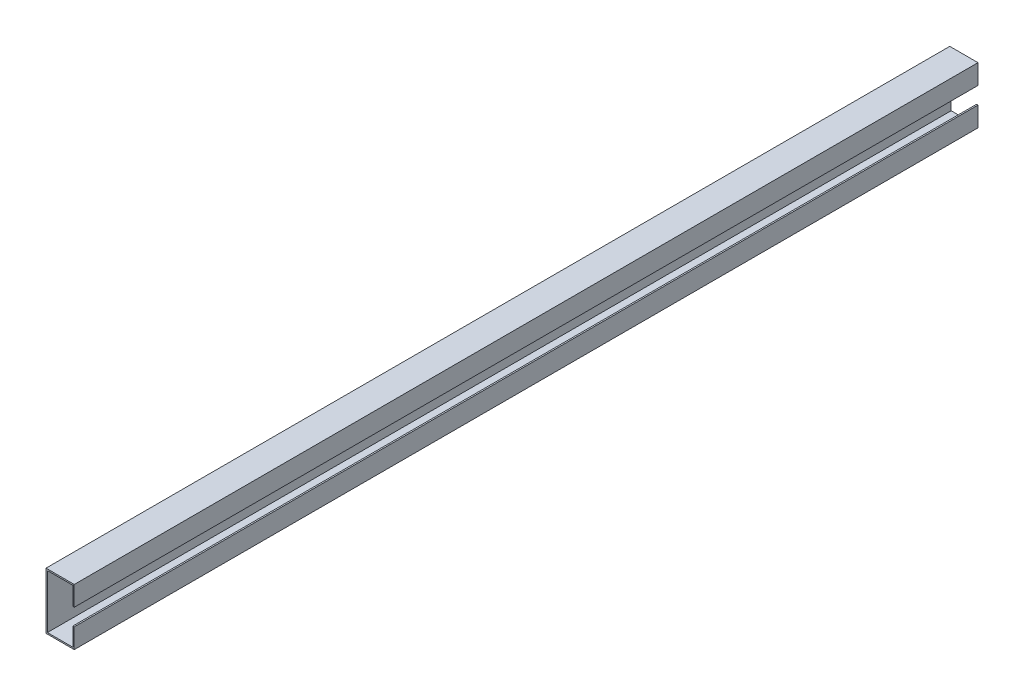
from build123d import *

# Parameters (mm, degrees)
CROQUIS1_W              = 50
CROQUIS1_H              = 100
CROQUIS1_W_2            = 45
CROQUIS1_H_2            = 95
SALIENTE_EXTRUIR1_DEPTH = 800
CROQUIS2_W              = 1600
CROQUIS2_H              = 30
CORTAR_EXTRUIR1_DEPTH   = 5


with BuildPart() as part:
    # Croquis1 → Saliente-Extruir1 (new, symmetric)
    with BuildSketch(Plane.XY):
        Rectangle(CROQUIS1_W, CROQUIS1_H)
        Rectangle(CROQUIS1_W_2, CROQUIS1_H_2, mode=Mode.SUBTRACT)
    extrude(amount=SALIENTE_EXTRUIR1_DEPTH, both=True)

    # Croquis2 → Cortar-Extruir1 (cut)
    with BuildSketch(Plane(origin=(25, 0, 0), x_dir=(0, 0, -1), z_dir=(1, 0, 0))):
        Rectangle(CROQUIS2_W, CROQUIS2_H)
    extrude(amount=-CORTAR_EXTRUIR1_DEPTH, mode=Mode.SUBTRACT)


solid = part.part
